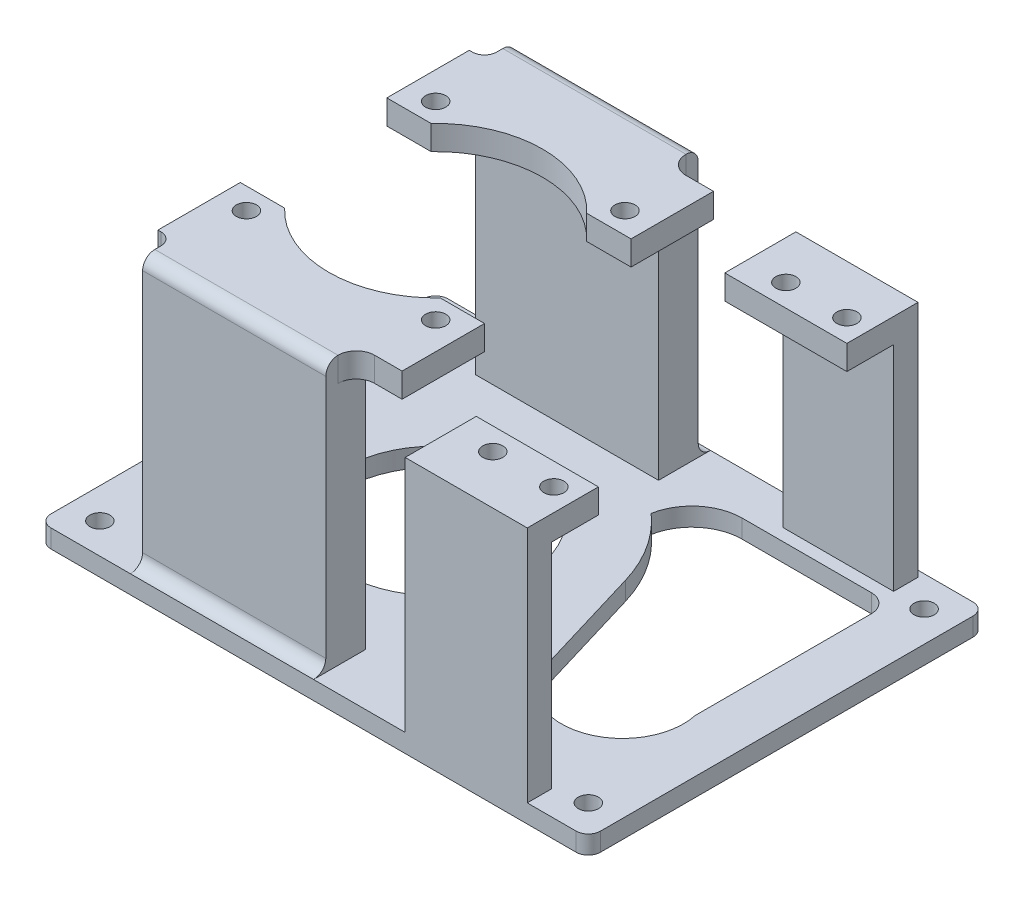
from build123d import *

# Parameters (mm, degrees)
SKETCH_1_R                = 1.65
EXTRUDE_2_DEPTH           = 3
SKETCH_2_W                = 30
SKETCH_2_H                = 5
EXTRUDE_3_DEPTH           = 40
FILLET_1_R                = 2
EXTRUDE_START             = -30
EXTRUDE_4_DEPTH           = 30
EXTRUDE_4_2_OUTLINE_R     = 1.65
EXTRUDE_4_2_DEPTH         = 4
CUT_EXTRUDE_START         = -30
CUT_EXTRUDE_1_DEPTH       = 30
CUT_EXTRUDE_START_2       = -32.5
CUT_EXTRUDE_1_2_DEPTH     = 40
CUT_EXTRUDE_START_3       = -3
CUT_EXTRUDE_1_3_OUTLINE_R = 15
CUT_EXTRUDE_1_3_DEPTH     = 3
SKETCH_7_W                = 18.132065191
SKETCH_7_H                = 4
SKETCH_7_R                = 10
SKETCH_7_W_2              = 20
EXTRUDE_6_DEPTH           = 35
SKETCH_9_W                = 20
SKETCH_9_H                = 11.65
SKETCH_9_R                = 1.65
EXTRUDE_7_DEPTH           = 4
CUT_EXTRUDE_START_4       = -31.5
CUT_EXTRUDE_2_DEPTH       = 4
CUT_EXTRUDE_START_5       = -39
CUT_EXTRUDE_2_2_OUTLINE_R = 10
CUT_EXTRUDE_2_2_DEPTH     = 40
CUT_EXTRUDE_START_6       = -1000
CUT_EXTRUDE_3_DEPTH       = 1000
SKETCH_13_W               = 30
SKETCH_13_H               = 1.5
EXTRUDE_8_DEPTH           = 40


with BuildPart() as part:
    # 草图1 → 凸台-拉伸2 (new body)
    with BuildSketch(Plane(origin=(0, 0, 0), x_dir=(1, 0, 0), z_dir=(0, 1, 0))):
        with BuildLine():
            Line((-43, 32.5), (43, 32.5))
            ThreePointArc((43, 32.5), (44.414213562, 31.914213562), (45, 30.5))
            Line((45, 30.5), (45, -30.5))
            ThreePointArc((45, -30.5), (44.414213562, -31.914213562), (43, -32.5))
            Line((43, -32.5), (-43, -32.5))
            ThreePointArc((-43, -32.5), (-44.414213562, -31.914213562), (-45, -30.5))
            Line((-45, -30.5), (-45, 30.5))
            ThreePointArc((-45, 30.5), (-44.414213562, 31.914213562), (-43, 32.5))
        make_face()
        with Locations(Location((-40, 27.5, 0), (0, 0, 270))):
            Circle(SKETCH_1_R, mode=Mode.SUBTRACT)
        with Locations(Location((40, 27.5, 0), (0, 0, 270))):
            Circle(SKETCH_1_R, mode=Mode.SUBTRACT)
        with Locations(Location((-40, -27.5, 0), (0, 0, 270))):
            Circle(SKETCH_1_R, mode=Mode.SUBTRACT)
        with Locations(Location((40, -27.5, 0), (0, 0, 270))):
            Circle(SKETCH_1_R, mode=Mode.SUBTRACT)
    extrude(amount=EXTRUDE_2_DEPTH)

    # 草图2 → 凸台-拉伸3 (add)
    with BuildSketch(Plane(origin=(0, 3, 0), x_dir=(1, 0, 0), z_dir=(0, 1, 0))):
        with Locations((-15, 28)):
            Rectangle(SKETCH_2_W, SKETCH_2_H)
        with Locations((-15, -28)):
            Rectangle(SKETCH_2_W, SKETCH_2_H)
    extrude(amount=EXTRUDE_3_DEPTH)

    # 圆角1
    fillet_1_edges = [part.edges().sort_by_distance(p)[0] for p in [
        (-15, 3, -30.5),
    ]]
    fillet(fillet_1_edges, radius=FILLET_1_R - 0.0001)  # a hair under: the kernel refuses the full size

    # 凸台-拉伸4: read off the stored shape, not the designer's step
    # 凸台-拉伸4 outline → 凸台-拉伸4 (add)
    with BuildSketch(Plane.YZ.offset(EXTRUDE_START)):
        with BuildLine():
            ThreePointArc((5, 30.5), (3.585786438, 31.085786438), (3, 32.5))
            Line((3, 32.5), (3, 30.5))
            Line((3, 30.5), (5, 30.5))
        make_face()
    extrude(amount=EXTRUDE_4_DEPTH)

    # Extrude 4 2 outline → Extrude 4 2 (add)
    # profile 1 of 2: a face of its own
    with BuildSketch(Plane(origin=(0, 43, 0), x_dir=(1, 0, 0), z_dir=(0, 1, 0))):
        with BuildLine():
            Line((7.5, 12), (7.5, 25.5))
            Line((7.5, 25.5), (3, 25.5))
            ThreePointArc((3, 25.5), (0.878679656, 26.378679656), (0, 28.5))
            Line((0, 28.5), (0, 30.5))
            Line((0, 30.5), (-30, 30.5))
            Line((-30, 30.5), (-30, 27.5))
            ThreePointArc((-30, 27.5), (-30.585786438, 26.085786438), (-32, 25.5))
            Line((-32, 25.5), (-32.5, 25.5))
            Line((-32.5, 25.5), (-32.5, 12))
            Line((-32.5, 12), (-25.237739203, 12))
            ThreePointArc((-25.237739203, 12), (-12.5, 17.5), (0.237739203, 12))
            Line((0.237739203, 12), (7.5, 12))
        make_face()
        with Locations((-28, 15.5)):
            Circle(EXTRUDE_4_2_OUTLINE_R, mode=Mode.SUBTRACT)
        with Locations((3, 15.5)):
            Circle(EXTRUDE_4_2_OUTLINE_R, mode=Mode.SUBTRACT)
    # profile 2 of 2: a face of its own
    with BuildSketch(Plane(origin=(0, 43, 0), x_dir=(1, 0, 0), z_dir=(0, 1, 0))):
        with BuildLine():
            Line((-25.237739203, -12), (-32.5, -12))
            Line((-32.5, -12), (-32.5, -25.5))
            Line((-32.5, -25.5), (-32, -25.5))
            ThreePointArc((-32, -25.5), (-30.585786438, -26.085786438), (-30, -27.5))
            Line((-30, -27.5), (-30, -30.5))
            Line((-30, -30.5), (0, -30.5))
            Line((0, -30.5), (0, -28.5))
            ThreePointArc((0, -28.5), (0.878679656, -26.378679656), (3, -25.5))
            Line((3, -25.5), (7.5, -25.5))
            Line((7.5, -25.5), (7.5, -12))
            Line((7.5, -12), (0.237739203, -12))
            ThreePointArc((0.237739203, -12), (-12.5, -17.5), (-25.237739203, -12))
        make_face()
        with Locations((-28, -15.5)):
            Circle(EXTRUDE_4_2_OUTLINE_R, mode=Mode.SUBTRACT)
        with Locations((3, -15.5)):
            Circle(EXTRUDE_4_2_OUTLINE_R, mode=Mode.SUBTRACT)
    extrude(amount=EXTRUDE_4_2_DEPTH)

    # 切除-拉伸1: read off the stored shape, not the designer's step
    # 切除-拉伸1 outline → 切除-拉伸1 (add)
    with BuildSketch(Plane.YZ.offset(CUT_EXTRUDE_START)):
        with BuildLine():
            ThreePointArc((40, 25.5), (42.121320344, 24.621320344), (43, 22.5))
            Line((43, 22.5), (43, 25.5))
            Line((43, 25.5), (40, 25.5))
        make_face()
        with BuildLine():
            ThreePointArc((43, -22.5), (42.121320344, -24.621320344), (40, -25.5))
            Line((40, -25.5), (43, -25.5))
            Line((43, -25.5), (43, -22.5))
        make_face()
    extrude(amount=CUT_EXTRUDE_1_DEPTH)

    # Cut-Extrude 1 2 outline → Cut-Extrude 1 2 (cut)
    with BuildSketch(Plane.YZ.offset(CUT_EXTRUDE_START_2)):
        with BuildLine():
            Line((47, 30.5), (45, 30.5))
            ThreePointArc((45, 30.5), (46.414213562, 29.914213562), (47, 28.5))
            Line((47, 28.5), (47, 30.5))
        make_face()
        with BuildLine():
            Line((47, -30.5), (47, -28.5))
            ThreePointArc((47, -28.5), (46.414213562, -29.914213562), (45, -30.5))
            Line((45, -30.5), (47, -30.5))
        make_face()
    extrude(amount=CUT_EXTRUDE_1_2_DEPTH, mode=Mode.SUBTRACT)

    # Cut-Extrude 1 3 outline → Cut-Extrude 1 3 (cut)
    with BuildSketch(Plane(origin=(0, 3, 0), x_dir=(1, 0, 0), z_dir=(0, 1, 0)).offset(CUT_EXTRUDE_START_3)):
        with Locations((-12.5, 0)):
            Circle(CUT_EXTRUDE_1_3_OUTLINE_R)
    extrude(amount=CUT_EXTRUDE_1_3_DEPTH, mode=Mode.SUBTRACT)

    # 草图7 → 凸台-拉伸6 (add)
    with BuildSketch(Plane(origin=(0, 3, 0), x_dir=(1, 0, 0), z_dir=(0, 1, 0))):
        with Locations((25.933967405, 29.5)):
            Rectangle(SKETCH_7_W, SKETCH_7_H)
        with Locations(Location((26.586442662, -8.5, 0), (0, 0, 270))):
            Circle(SKETCH_7_R)
        with Locations((25, -30.5)):
            Rectangle(SKETCH_7_W_2, SKETCH_7_H)
    extrude(amount=EXTRUDE_6_DEPTH)

    # 草图9 → 凸台-拉伸7 (add)
    # profile 1 of 2: a face of its own
    with BuildSketch(Plane(origin=(0, 38, 0), x_dir=(1, 0, 0), z_dir=(0, 1, 0))):
        with Locations((25, 25.675)):
            Rectangle(SKETCH_9_W, SKETCH_9_H)
        with Locations(Location((31.355501541, 23.5, 0), (0, 0, 270))):
            Circle(SKETCH_9_R, mode=Mode.SUBTRACT)
        with Locations(Location((21.355501541, 23.5, 0), (0, 0, 270))):
            Circle(SKETCH_9_R, mode=Mode.SUBTRACT)
    # profile 2 of 2: a face of its own
    with BuildSketch(Plane(origin=(0, 38, 0), x_dir=(1, 0, 0), z_dir=(0, 1, 0))):
        with Locations((25, -26.675)):
            Rectangle(SKETCH_9_W, SKETCH_9_H)
        with Locations(Location((31.355501541, -24.5, 0), (0, 0, 270))):
            Circle(SKETCH_9_R, mode=Mode.SUBTRACT)
        with Locations(Location((21.355501541, -24.5, 0), (0, 0, 270))):
            Circle(SKETCH_9_R, mode=Mode.SUBTRACT)
    extrude(amount=EXTRUDE_7_DEPTH)

    # 切除-拉伸2: read off the stored shape, not the designer's step
    # 切除-拉伸2 outline → 切除-拉伸2 (add)
    with BuildSketch(Plane.XY.offset(CUT_EXTRUDE_START_4)):
        with BuildLine():
            ThreePointArc((15.367934809, 38), (16.42859498, 37.560660171), (16.867934809, 36.5))
            Line((16.867934809, 36.5), (16.867934809, 38))
            Line((16.867934809, 38), (15.367934809, 38))
        make_face()
    extrude(amount=CUT_EXTRUDE_2_DEPTH)

    # Cut-Extrude 2 2 outline → Cut-Extrude 2 2 (cut)
    with BuildSketch(Plane(origin=(0, 38, 0), x_dir=(1, 0, 0), z_dir=(0, 1, 0)).offset(CUT_EXTRUDE_START_5)):
        with Locations((26.586442662, -8.5)):
            Circle(CUT_EXTRUDE_2_2_OUTLINE_R)
    extrude(amount=CUT_EXTRUDE_2_2_DEPTH, mode=Mode.SUBTRACT)

    # 草图11 → 切除-拉伸3 (cut)
    with BuildSketch(Plane(origin=(0, 3, 0), x_dir=(1, 0, 0), z_dir=(0, 1, 0)).offset(CUT_EXTRUDE_START_6)):
        with BuildLine():
            Line((36.351968475, -6.347209811), (36.351968475, 22.5))
            ThreePointArc((36.351968475, 22.5), (35.473288819, 24.621320344), (33.351968475, 25.5))
            Line((33.351968475, 25.5), (12.201289858, 25.5))
            ThreePointArc((12.201289858, 25.5), (6.908991343, 23.578301134), (4.082716458, 18.708648131))
            ThreePointArc((4.082716458, 18.708648131), (8.569131741, 13.457031161), (11.447301334, 7.178214179))
            Line((11.447301334, 7.178214179), (17.007522129, -11.371285672))
            ThreePointArc((17.007522129, -11.371285672), (24.072672596, 1.178892501), (36.351968475, -6.347209811))
        make_face()
    extrude(amount=CUT_EXTRUDE_3_DEPTH, mode=Mode.SUBTRACT)

    # 草图13 → 凸台-拉伸8 (add)
    with BuildSketch(Plane(origin=(0, 3, 0), x_dir=(1, 0, 0), z_dir=(0, 1, 0))):
        with Locations((-15, 24.75)):
            Rectangle(SKETCH_13_W, SKETCH_13_H)
        with Locations((-15, -24.75)):
            Rectangle(SKETCH_13_W, SKETCH_13_H)
    extrude(amount=EXTRUDE_8_DEPTH)


solid = part.part
